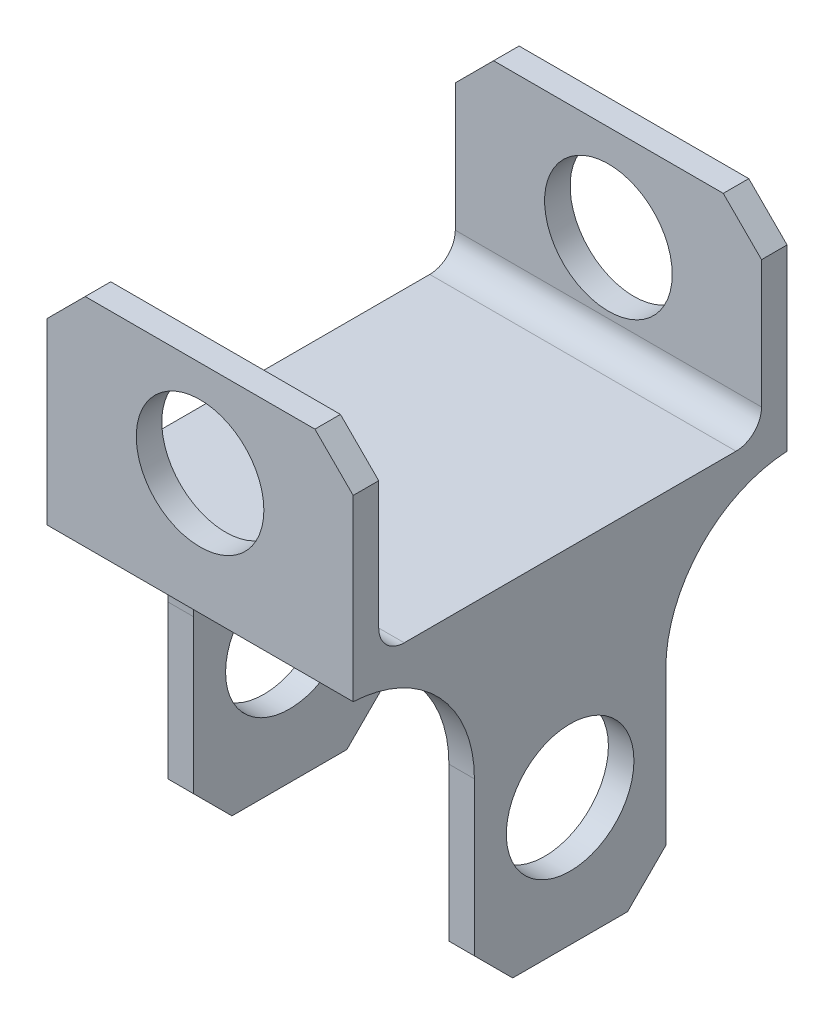
from build123d import *

# Parameters (mm, degrees)
SKETCH1_W           = 24
SKETCH1_H           = 15
SKETCH1_R           = 5
SKETCH1_H_2         = 2
BOSS_EXTRUDE1_DEPTH = 2
SKETCH1_3_W         = 24
SKETCH1_3_H         = 2
BOSS_EXTRUDE2_DEPTH = 30
SKETCH3_W           = 2
SKETCH3_H           = 34
BOSS_EXTRUDE3_DEPTH = 25
SKETCH4_W           = 2
SKETCH4_H           = 9.5
CUT_EXTRUDE1_DEPTH  = 25
SKETCH5_R           = 5
CUT_EXTRUDE2_DEPTH  = 64.437930135
FILLET1_R           = 10
FILLET2_R           = 2
CHAMFER1_SIZE       = 3


with BuildPart() as part:
    # Sketch1 → Boss-Extrude1 (new body)
    # profile 1 of 2: a face of its own
    with BuildSketch(Plane.XY):
        Rectangle(SKETCH1_W, SKETCH1_H)
        Circle(SKETCH1_R, mode=Mode.SUBTRACT)
    # profile 2 of 2: a face of its own
    with BuildSketch(Plane.XY):
        with Locations((0, -8.5)):
            Rectangle(SKETCH1_W, SKETCH1_H_2)
    boss_extrude1 = extrude(amount=BOSS_EXTRUDE1_DEPTH)

    # Sketch1<3> → Boss-Extrude2 (add)
    with BuildSketch(Plane.XY):
        with Locations((0, -8.5)):
            Rectangle(SKETCH1_3_W, SKETCH1_3_H)
    extrude(amount=-BOSS_EXTRUDE2_DEPTH)

    # Mirror1: Boss-Extrude1 across plane
    add(boss_extrude1.mirror(Plane(origin=(0, 0, -15), x_dir=(1, 0, 0), z_dir=(0, 0, -1))))

    # Sketch3 → Boss-Extrude3 (add)
    with BuildSketch(Plane.XZ.offset(9.5)):
        with Locations((-11, -15)):
            Rectangle(SKETCH3_W, SKETCH3_H)
        with Locations((11, -15)):
            Rectangle(SKETCH3_W, SKETCH3_H)
    extrude(amount=BOSS_EXTRUDE3_DEPTH)

    # Sketch4 → Cut-Extrude1 (cut)
    with BuildSketch(Plane.XZ.offset(34.5)):
        with Locations((-11, -27.25)):
            Rectangle(SKETCH4_W, SKETCH4_H)
        with Locations((-11, -2.75)):
            Rectangle(SKETCH4_W, SKETCH4_H)
        with Locations((11, -2.75)):
            Rectangle(SKETCH4_W, SKETCH4_H)
        with Locations((11, -27.25)):
            Rectangle(SKETCH4_W, SKETCH4_H)
    extrude(amount=-CUT_EXTRUDE1_DEPTH, mode=Mode.SUBTRACT)

    # Sketch5 → Cut-Extrude2 (cut)
    with BuildSketch(Plane(origin=(12, 0, 0), x_dir=(0, 0, -1), z_dir=(1, 0, 0))):
        with Locations((15, -24.5)):
            Circle(SKETCH5_R)
    extrude(amount=-CUT_EXTRUDE2_DEPTH, mode=Mode.SUBTRACT)

    # Fillet1
    # the kernel refuses this fillet: 10 mm, written as the material it adds along each edge
    with BuildSketch(Plane(origin=(12, -9.5, -7.5), x_dir=(0, 0, 1), z_dir=(-1, 0, 0)), Plane(origin=(-10, -9.5, -7.5), x_dir=(0, 0, 1), z_dir=(-1, 0, 0))) as fillet1_piece_1:
        with BuildLine():
            CenterArc((10, -9.987492178), FILLET1_R, 92.865983983, 87.134016017)
            Line((0, -9.987492178), (-0.2, -9.987492178))
            Line((-0.2, -9.987492178), (-0.2, 0))
            Line((-0.2, 0), (0, 0.2))
            ThreePointArc((0, 0.2), (4.75, 0.2), (9.49, 0.199749844))
            Line((9.49, 0.199749844), (9.5, 0))
        make_face()
    extrude(amount=2)
    with BuildSketch(Plane(origin=(12, -9.5, -7.5), x_dir=(0, 0, 1), z_dir=(-1, 0, 0))) as fillet1_piece_2_section:
        with BuildLine():
            CenterArc((10, -9.987492178), FILLET1_R, 92.865983983, 87.134016017)
            Line((0, -9.987492178), (-0.2, -9.987492178))
            Line((-0.2, -9.987492178), (-0.2, 0))
            Line((-0.2, 0), (0, 0.2))
            ThreePointArc((0, 0.2), (4.75, 0.2), (9.49, 0.199749844))
            Line((9.49, 0.199749844), (9.5, 0))
        make_face()
    fillet1_piece_2 = extrude(amount=26.968730444, mode=Mode.PRIVATE)
    fillet1_piece_2 = split(fillet1_piece_2, bisect_by=Plane(origin=(-12, -11.774818107, -5.276261627), z_dir=(1, 0, 0)), keep=Keep.TOP, mode=Mode.PRIVATE)
    fillet1_piece_2 = split(fillet1_piece_2, bisect_by=Plane(origin=(-10, -11.774818107, -5.276261627), z_dir=(-1, 0, 0)), keep=Keep.TOP, mode=Mode.PRIVATE)
    add(fillet1_piece_2)
    with BuildSketch(Plane(origin=(12, -9.5, -22.5), x_dir=(0, 0, -1), z_dir=(-1, 0, 0)), Plane(origin=(-10, -9.5, -22.5), x_dir=(0, 0, -1), z_dir=(-1, 0, 0))) as fillet1_piece_3:
        with BuildLine():
            CenterArc((10, 9.987492178), FILLET1_R, 180, 87.134016017)
            Line((0, 9.987492178), (-0.2, 9.987492178))
            Line((-0.2, 9.987492178), (-0.2, 0))
            Line((-0.2, 0), (0, -0.2))
            ThreePointArc((0, -0.2), (4.75, -0.2), (9.49, -0.199749844))
            Line((9.49, -0.199749844), (9.5, 0))
        make_face()
    extrude(amount=2)
    with BuildSketch(Plane(origin=(12, -9.5, -22.5), x_dir=(0, 0, -1), z_dir=(-1, 0, 0))) as fillet1_piece_4_section:
        with BuildLine():
            CenterArc((10, 9.987492178), FILLET1_R, 180, 87.134016017)
            Line((0, 9.987492178), (-0.2, 9.987492178))
            Line((-0.2, 9.987492178), (-0.2, 0))
            Line((-0.2, 0), (0, -0.2))
            ThreePointArc((0, -0.2), (4.75, -0.2), (9.49, -0.199749844))
            Line((9.49, -0.199749844), (9.5, 0))
        make_face()
    fillet1_piece_4 = extrude(amount=26.968730444, mode=Mode.PRIVATE)
    fillet1_piece_4 = split(fillet1_piece_4, bisect_by=Plane(origin=(-12, -11.774818107, -24.723738373), z_dir=(1, 0, 0)), keep=Keep.TOP, mode=Mode.PRIVATE)
    fillet1_piece_4 = split(fillet1_piece_4, bisect_by=Plane(origin=(-10, -11.774818107, -24.723738373), z_dir=(-1, 0, 0)), keep=Keep.TOP, mode=Mode.PRIVATE)
    add(fillet1_piece_4)
    with BuildSketch(Plane(origin=(14.968730444, -9.5, -22.5), x_dir=(0, 0, -1), z_dir=(-1, 0, 0))) as fillet1_piece_5_section:
        with BuildLine():
            CenterArc((10, 9.987492178), FILLET1_R, 180, 87.134016017)
            Line((0, 9.987492178), (-0.2, 9.987492178))
            Line((-0.2, 9.987492178), (-0.2, 0))
            Line((-0.2, 0), (0, -0.2))
            ThreePointArc((0, -0.2), (4.75, -0.2), (9.49, -0.199749844))
            Line((9.49, -0.199749844), (9.5, 0))
        make_face()
    fillet1_piece_5 = extrude(amount=26.968730444, mode=Mode.PRIVATE)
    fillet1_piece_5 = split(fillet1_piece_5, bisect_by=Plane(origin=(12, -11.774818107, -24.723738373), z_dir=(-1, 0, 0)), keep=Keep.TOP, mode=Mode.PRIVATE)
    fillet1_piece_5 = split(fillet1_piece_5, bisect_by=Plane(origin=(10, -11.774818107, -24.723738373), z_dir=(1, 0, 0)), keep=Keep.TOP, mode=Mode.PRIVATE)
    add(fillet1_piece_5)
    with BuildSketch(Plane(origin=(14.968730444, -9.5, -7.5), x_dir=(0, 0, 1), z_dir=(-1, 0, 0))) as fillet1_piece_6_section:
        with BuildLine():
            CenterArc((10, -9.987492178), FILLET1_R, 92.865983983, 87.134016017)
            Line((0, -9.987492178), (-0.2, -9.987492178))
            Line((-0.2, -9.987492178), (-0.2, 0))
            Line((-0.2, 0), (0, 0.2))
            ThreePointArc((0, 0.2), (4.75, 0.2), (9.49, 0.199749844))
            Line((9.49, 0.199749844), (9.5, 0))
        make_face()
    fillet1_piece_6 = extrude(amount=26.968730444, mode=Mode.PRIVATE)
    fillet1_piece_6 = split(fillet1_piece_6, bisect_by=Plane(origin=(12, -11.774818107, -5.276261627), z_dir=(-1, 0, 0)), keep=Keep.TOP, mode=Mode.PRIVATE)
    fillet1_piece_6 = split(fillet1_piece_6, bisect_by=Plane(origin=(10, -11.774818107, -5.276261627), z_dir=(1, 0, 0)), keep=Keep.TOP, mode=Mode.PRIVATE)
    add(fillet1_piece_6)

    # Fillet2
    fillet2_edges = [part.edges().sort_by_distance(p)[0] for p in [
        (0, -7.5, 0),
        (0, -7.5, -30),
    ]]
    fillet(fillet2_edges, radius=FILLET2_R)

    # Chamfer1
    chamfer1_edges = [part.edges().sort_by_distance(p)[0] for p in [
        (-11, -34.5, -7.5),
        (-12, 7.5, 1),
        (12, 7.5, 1),
        (-11, -34.5, -22.5),
        (-12, 7.5, -31),
        (12, 7.5, -31),
        (11, -34.5, -22.5),
        (11, -34.5, -7.5),
    ]]
    chamfer(chamfer1_edges, length=CHAMFER1_SIZE)


solid = part.part
